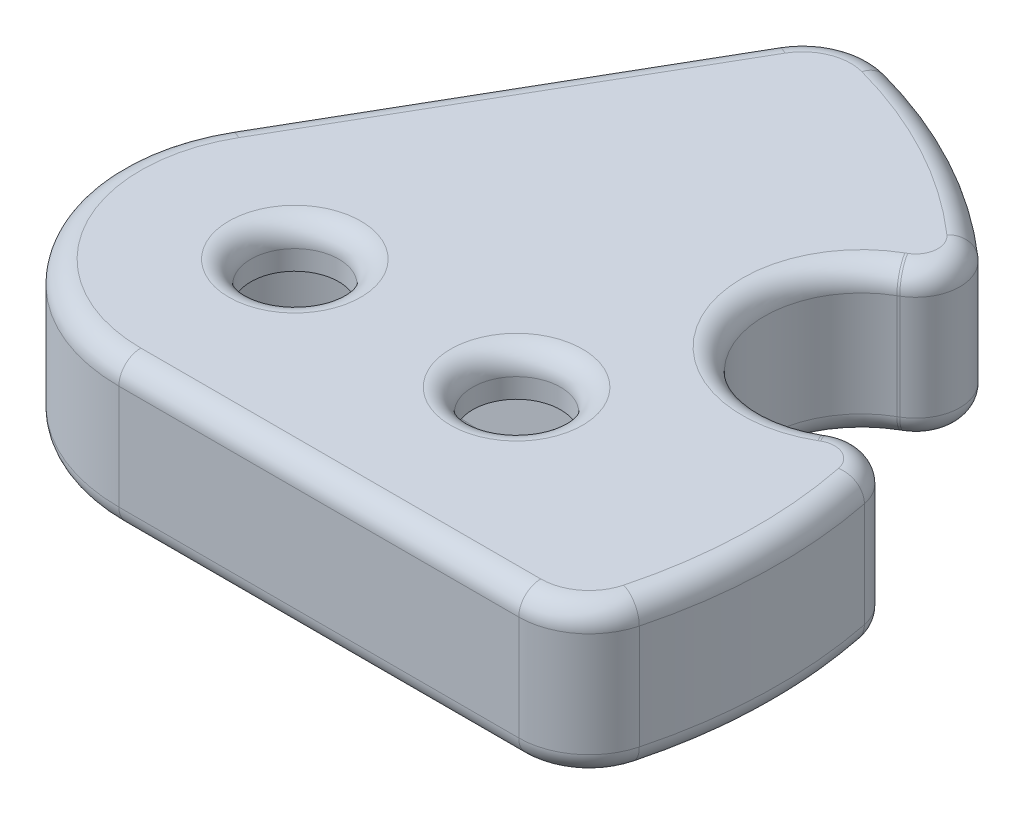
from build123d import *

# Parameters (mm, degrees)
BOSS_EXTRUDE1_DEPTH = 4.5
FILLET4_R           = 2.54
SKETCH2_R           = 1.5875
BOSS_EXTRUDE2_DEPTH = 1.5
CUT_EXTRUDE1_DEPTH  = 0.635
FILLET1_R           = 1.5875
FILLET2_R           = 0.79375
FILLET3_R           = 0.79375


with BuildPart() as part:
    # Sketch1 → Boss-Extrude1 (new body)
    with BuildSketch(Plane(origin=(0, 0, 0), x_dir=(1, 0, 0), z_dir=(0, 1, 0))):
        with BuildLine():
            Line((11.207905104, 10.512338913), (13.066095292, 11.585165518))
            ThreePointArc((13.066095292, 11.585165518), (8.347679713, 15.338029523), (2.634255856, 17.262664984))
            Line((2.634255856, 17.262664984), (-5.499261314, 3.175))
            ThreePointArc((-5.499261314, 3.175), (-5.499261314, -3.175), (0, -6.35))
            Line((0, -6.35), (16.267034341, -6.35))
            ThreePointArc((16.267034341, -6.35), (17.456963068, -0.439712068), (16.566095292, 5.522987692))
            Line((16.566095292, 5.522987692), (14.707905104, 4.450161087))
            ThreePointArc((14.707905104, 4.450161087), (9.926816191, 5.73125), (11.207905104, 10.512338913))
        make_face()
        with BuildLine():
            Line((2.286372673, 2.65), (14.110293316, 1.99695653))
            ThreePointArc((14.110293316, 1.99695653), (16, 0), (14.110293316, -1.99695653))
            Line((14.110293316, -1.99695653), (2.286372673, -2.65))
            ThreePointArc((2.286372673, -2.65), (-3.5, 0), (2.286372673, 2.65))
        make_face(mode=Mode.SUBTRACT)
    extrude(amount=BOSS_EXTRUDE1_DEPTH)

    # Fillet4
    fillet4_edges = [part.edges().sort_by_distance(p)[0] for p in [
        (2.634255856, 2.25, -17.262664984),
        (16.267034341, 2.25, 6.35),
    ]]
    fillet(fillet4_edges, radius=FILLET4_R)

    # Sketch2 → Boss-Extrude2 (add)
    with BuildSketch(Plane(origin=(0, 4.5, 0), x_dir=(1, 0, 0), z_dir=(0, 1, 0))):
        with BuildLine():
            Line((16.566095292, 5.522987692), (14.707905104, 4.450161087))
            ThreePointArc((14.707905104, 4.450161087), (9.926816191, 5.73125), (11.207905104, 10.512338913))
            Line((11.207905104, 10.512338913), (13.066095292, 11.585165518))
            ThreePointArc((13.066095292, 11.585165518), (9.207848343, 14.837602069), (4.580685232, 16.851000832))
            ThreePointArc((4.580685232, 16.851000832), (2.94663875, 16.748356461), (1.714699218, 15.669946166))
            Line((1.714699218, 15.669946166), (-5.499261314, 3.175))
            ThreePointArc((-5.499261314, 3.175), (-5.499261314, -3.175), (0, -6.35))
            Line((0, -6.35), (14.427921065, -6.35))
            ThreePointArc((14.427921065, -6.35), (15.977821542, -5.822314218), (16.883737416, -4.458510638))
            ThreePointArc((16.883737416, -4.458510638), (17.453664494, 0.555429545), (16.566095292, 5.522987692))
        make_face()
        with Locations(Location((0, 0, 0), (0, 0, 270))):
            Circle(SKETCH2_R, mode=Mode.SUBTRACT)
        with Locations(Location((8, 0, 0), (0, 0, 270))):
            Circle(SKETCH2_R, mode=Mode.SUBTRACT)
    extrude(amount=BOSS_EXTRUDE2_DEPTH)

    # Sketch3 → Cut-Extrude1 (cut)
    with BuildSketch(Plane.XZ):
        with BuildLine():
            Line((-5.499261314, -3.175), (1.714699218, -15.669946166))
            ThreePointArc((1.714699218, -15.669946166), (2.94663875, -16.748356461), (4.580685232, -16.851000832))
            ThreePointArc((4.580685232, -16.851000832), (9.207848343, -14.837602069), (13.066095292, -11.585165518))
            Line((13.066095292, -11.585165518), (11.207905104, -10.512338913))
            ThreePointArc((11.207905104, -10.512338913), (9.926816191, -5.73125), (14.707905104, -4.450161087))
            Line((14.707905104, -4.450161087), (16.566095292, -5.522987692))
            ThreePointArc((16.566095292, -5.522987692), (17.453664494, -0.555429545), (16.883737416, 4.458510638))
            ThreePointArc((16.883737416, 4.458510638), (15.977821542, 5.822314218), (14.427921065, 6.35))
            Line((14.427921065, 6.35), (0, 6.35))
            ThreePointArc((0, 6.35), (-5.499261314, 3.175), (-5.499261314, -3.175))
        make_face()
    extrude(amount=-CUT_EXTRUDE1_DEPTH, mode=Mode.SUBTRACT)

    # Fillet1
    fillet1_edges = [part.edges().sort_by_distance(p)[0] for p in [
        (13.066095292, 3.3175, -11.585165518),
        (16.566095292, 3.3175, -5.522987692),
    ]]
    fillet(fillet1_edges, radius=FILLET1_R)

    # Fillet2
    # the kernel refuses this fillet: 0.79375 mm, written as the material it takes off along each edge
    with BuildSketch(Plane(origin=(0.305017366, 0.635, 2.75943165), x_dir=(0.05514665822650493, 0, 0.9984782652048311), z_dir=(0.9984782652048312, 0, -0.055146658226504934)), Plane(origin=(14.110293316, 0.635, -1.99695653), x_dir=(0.055146658226504934, 0, -0.9984782652048311), z_dir=(-0.9984782652048312, 0, -0.055146658226504934))) as fillet2_piece_1:
        with BuildLine():
            CenterArc((FILLET2_R, -FILLET2_R), FILLET2_R, 90, 90)
            Line((0, -FILLET2_R), (0, 0))
            Line((0, 0), (FILLET2_R, 0))
        make_face()
    extrude(amount=13.826315937, mode=Mode.SUBTRACT)
    with BuildSketch(Plane(origin=(0, 0.635, 0), x_dir=(0.958233566749164, 0, 0.28598676814701657), z_dir=(0.28598676814701657, 0, -0.958233566749164))) as fillet2_piece_2:
        with BuildLine():
            CenterArc((3.5 + FILLET2_R, -FILLET2_R), FILLET2_R, 90, 90)
            Line((3.5, -FILLET2_R), (3.5, 0))
            Line((3.5, 0), (3.5 + FILLET2_R, 0))
        make_face()
    revolve(axis=Axis((0, 0.635, 0), (0, -1, 0)), revolution_arc=326.764317032, mode=Mode.SUBTRACT)
    with BuildSketch(Plane(origin=(14, 0.635, 0), x_dir=(0.055146658226505, 0, -0.9984782652048312), z_dir=(-0.9984782652048312, 0, -0.055146658226505))) as fillet2_piece_3:
        with BuildLine():
            CenterArc((2 + FILLET2_R, -FILLET2_R), FILLET2_R, 90, 90)
            Line((2, -FILLET2_R), (2, 0))
            Line((2, 0), (2 + FILLET2_R, 0))
        make_face()
    revolve(axis=Axis((14, 0.635, 0), (0, -1, 0)), revolution_arc=173.677451052, mode=Mode.SUBTRACT)
    with BuildSketch(Plane(origin=(11.273045979, 0.635, -10.549948015), x_dir=(-0.5, 0, -0.8660254037844386), z_dir=(-0.8660254037844387, 0, 0.5000000000000001)), Plane(origin=(14.707905104, 0.635, -4.450161087), x_dir=(0.5000000000000067, 0, 0.8660254037844347), z_dir=(0.8660254037844348, 0, -0.5000000000000067))) as fillet2_piece_4:
        with BuildLine():
            CenterArc((FILLET2_R, -FILLET2_R), FILLET2_R, 90, 90)
            Line((0, -FILLET2_R), (0, 0))
            Line((0, 0), (FILLET2_R, 0))
        make_face()
    extrude(amount=0.075218203, mode=Mode.SUBTRACT)
    with BuildSketch(Plane(origin=(0, 0.635, 0), x_dir=(0.9805855734593999, 0, -0.19609164470547952), z_dir=(-0.19609164470547952, 0, -0.9805855734593999))) as fillet2_piece_5:
        with BuildLine():
            CenterArc((17.4625 - FILLET2_R, -FILLET2_R), FILLET2_R, 0, 90)
            Line((17.4625 - FILLET2_R, 0), (17.4625, 0))
            Line((17.4625, 0), (17.4625, -FILLET2_R))
        make_face()
    revolve(axis=Axis((0, 0.635, 0), (0, -1, 0)), revolution_arc=26.100998532, mode=Mode.SUBTRACT)
    with BuildSketch(Plane(origin=(10.479295979, 0.635, -11.924763343), x_dir=(0.6601131325145184, 0, -0.7511661948476316), z_dir=(-0.7511661948476316, 0, -0.6601131325145184))) as fillet2_piece_6:
        with BuildLine():
            CenterArc((1.5875 - FILLET2_R, -FILLET2_R), FILLET2_R, 0, 90)
            Line((1.5875, -FILLET2_R), (1.5875, 0))
            Line((1.5875, 0), (1.5875 - FILLET2_R, 0))
        make_face()
    revolve(axis=Axis((10.479295979, 0.635, -11.924763343), (0, -1, 0)), revolution_arc=108.69149851, mode=Mode.SUBTRACT)
    with BuildSketch(Plane(origin=(15.566795979, 0.635, -3.11295486), x_dir=(0.9805855734593999, 0, -0.1960916447054792), z_dir=(0.1960916447054792, 0, 0.9805855734593999))) as fillet2_piece_7:
        with BuildLine():
            CenterArc((1.5875 - FILLET2_R, FILLET2_R), FILLET2_R, 270, 90)
            Line((1.5875, FILLET2_R), (1.5875, 0))
            Line((1.5875, 0), (1.5875 - FILLET2_R, 0))
        make_face()
    revolve(axis=Axis((15.566795979, 0.635, -3.11295486), (0, 1, 0)), revolution_arc=108.69149851, mode=Mode.SUBTRACT)
    with BuildSketch(Plane(origin=(0, 0.635, 0), x_dir=(0, 0, 1), z_dir=(1, 0, 0))) as fillet2_piece_8:
        with BuildLine():
            CenterArc((6.35 - FILLET2_R, -FILLET2_R), FILLET2_R, 0, 90)
            Line((6.35, -FILLET2_R), (6.35, 0))
            Line((6.35, 0), (6.35 - FILLET2_R, 0))
        make_face()
    revolve(axis=Axis((0, 0.635, 0), (0, -1, 0)), revolution_arc=120, mode=Mode.SUBTRACT)
    with BuildSketch(Plane(origin=(14.427921065, 0.635, 6.35), x_dir=(0, 0, -1), z_dir=(-1, 0, 0)), Plane(origin=(-5.499261314, 0.635, -3.175), x_dir=(0.8660254037844398, 0, 0.49999999999999817), z_dir=(0.49999999999999817, 0, -0.8660254037844397))) as fillet2_piece_9:
        with BuildLine():
            CenterArc((FILLET2_R, -FILLET2_R), FILLET2_R, 90, 90)
            Line((0, -FILLET2_R), (0, 0))
            Line((0, 0), (FILLET2_R, 0))
        make_face()
    extrude(amount=14.427921065, mode=Mode.SUBTRACT)
    with BuildSketch(Plane(origin=(14.427921065, 0.635, 3.81), x_dir=(0.9668568312767465, 0, 0.25531914893616775), z_dir=(0.25531914893616775, 0, -0.9668568312767465))) as fillet2_piece_10:
        with BuildLine():
            CenterArc((2.54 - FILLET2_R, -FILLET2_R), FILLET2_R, 0, 90)
            Line((2.54, -FILLET2_R), (2.54, 0))
            Line((2.54, 0), (2.54 - FILLET2_R, 0))
        make_face()
    revolve(axis=Axis((14.427921065, 0.635, 3.81), (0, -1, 0)), revolution_arc=75.207502959, mode=Mode.SUBTRACT)
    with BuildSketch(Plane(origin=(12.957905104, 0.635, -7.48125), x_dir=(-0.5000000000000012, 0, -0.8660254037844379), z_dir=(0.8660254037844379, 0, -0.5000000000000012))) as fillet2_piece_11:
        with BuildLine():
            CenterArc((3.5 + FILLET2_R, FILLET2_R), FILLET2_R, 180, 90)
            Line((3.5, FILLET2_R), (3.5, 0))
            Line((3.5, 0), (3.5 + FILLET2_R, 0))
        make_face()
    revolve(axis=Axis((12.957905104, 0.635, -7.48125), (0, 1, 0)), revolution_arc=180, mode=Mode.SUBTRACT)
    with BuildSketch(Plane(origin=(0, 0.635, 0), x_dir=(0.26231554658702627, 0, -0.9649821521762719), z_dir=(-0.9649821521762719, 0, -0.26231554658702627))) as fillet2_piece_12:
        with BuildLine():
            CenterArc((17.4625 - FILLET2_R, -FILLET2_R), FILLET2_R, 0, 90)
            Line((17.4625, -FILLET2_R), (17.4625, 0))
            Line((17.4625, 0), (17.4625 - FILLET2_R, 0))
        make_face()
    revolve(axis=Axis((0, 0.635, 0), (0, -1, 0)), revolution_arc=26.100998532, mode=Mode.SUBTRACT)
    with BuildSketch(Plane(origin=(3.914403744, 0.635, -14.399946166), x_dir=(-0.8660254037844385, 0, -0.5000000000000003), z_dir=(-0.5000000000000003, 0, 0.8660254037844385))) as fillet2_piece_13:
        with BuildLine():
            CenterArc((2.54 - FILLET2_R, -FILLET2_R), FILLET2_R, 0, 90)
            Line((2.54, -FILLET2_R), (2.54, 0))
            Line((2.54, 0), (2.54 - FILLET2_R, 0))
        make_face()
    revolve(axis=Axis((3.914403744, 0.635, -14.399946166), (0, -1, 0)), revolution_arc=75.207502959, mode=Mode.SUBTRACT)

    # Fillet3
    fillet3_edges = [part.edges().sort_by_distance(p)[0] for p in [
        (14.740475541, 6, -4.468965637),
        (8.267493015, 6, -15.381399985),
        (12.059072088, 6, -11.768354602),
        (16.22123009, 6, -4.559285473),
        (0, 6, -1.5875),
        (8, 6, -1.5875),
        (-1.892281048, 6, -9.422473083),
        (-5.499261314, 6, 3.175),
        (7.213960532, 6, 6.35),
        (15.977821542, 6, 5.822314218),
        (17.45442964, 6, 0.530841016),
        (9.926816191, 6, -5.73125),
        (11.240475541, 6, -10.531143464),
        (2.94663875, 6, -16.748356461),
    ]]
    fillet(fillet3_edges, radius=FILLET3_R)


solid = part.part
